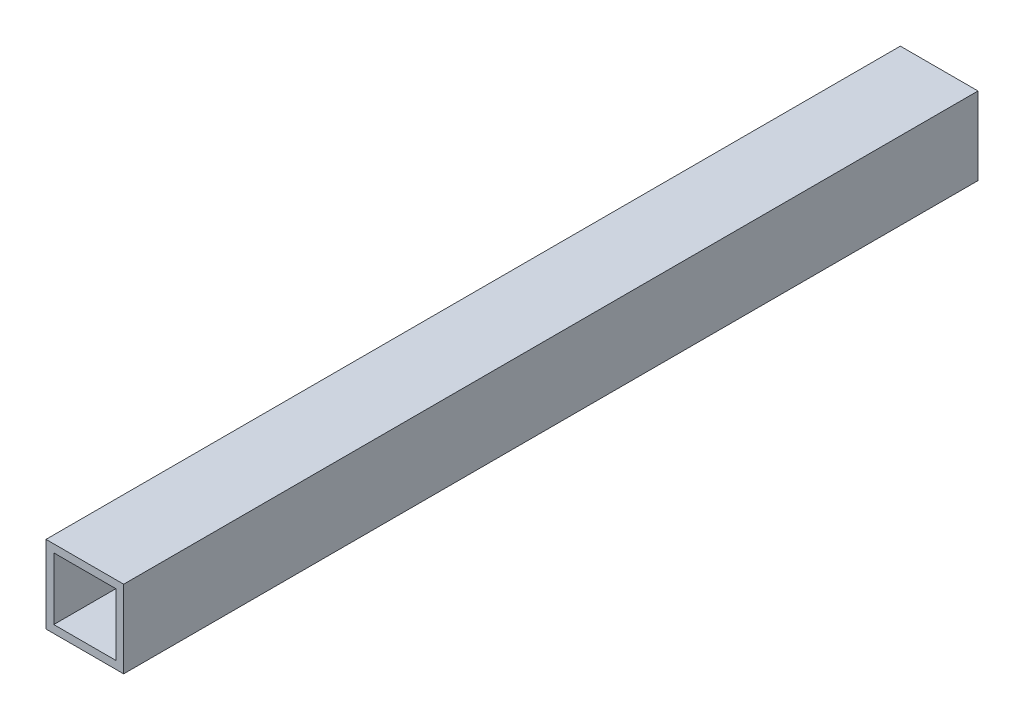
from build123d import *

# Parameters (mm, degrees)
SZKIC1_W                    = 20
SZKIC1_H                    = 20
SZKIC1_W_2                  = 16
SZKIC1_H_2                  = 16
DODANIE_WYCI_GNI_CIE1_DEPTH = 220


with BuildPart() as part:
    # Szkic1 → Dodanie-wyciągnięcie1 (new body)
    with BuildSketch(Plane.XY):
        Rectangle(SZKIC1_W, SZKIC1_H)
        Rectangle(SZKIC1_W_2, SZKIC1_H_2, mode=Mode.SUBTRACT)
    extrude(amount=DODANIE_WYCI_GNI_CIE1_DEPTH)


solid = part.part
